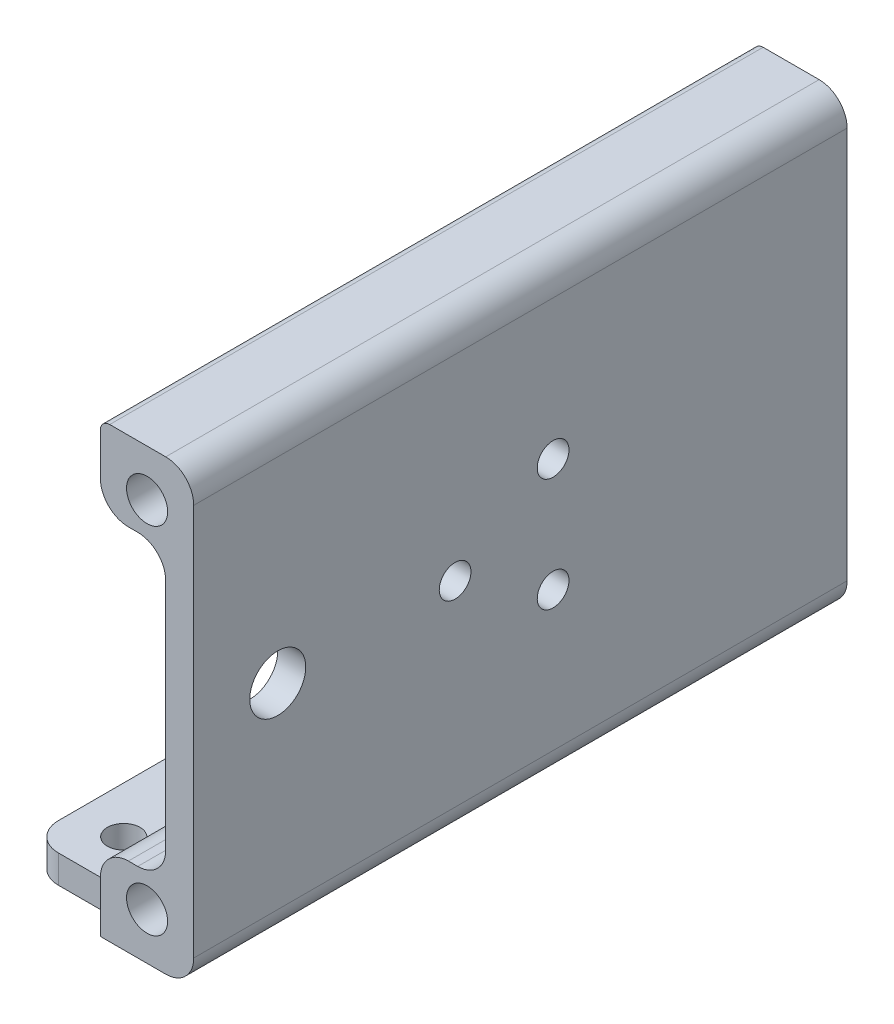
from build123d import *

# Parameters (mm, degrees)
BOSS_EXTRUDE1_DEPTH = 70
SKETCH2_R           = 2.2
CUT_EXTRUDE1_DEPTH  = 5.3
FILLET1_R           = 1
SKETCH4_R           = 1.7
SKETCH4_R_2         = 3
CUT_EXTRUDE3_DEPTH  = 10
SKETCH5_R           = 1.75
BOSS_EXTRUDE2_DEPTH = 3
CHAMFER1_SIZE       = 1


with BuildPart() as part:
    # Sketch1 → Boss-Extrude1 (new body)
    with BuildSketch(Plane.XY):
        with BuildLine():
            Line((49, 24), (49, 18.5))
            ThreePointArc((49, 18.5), (49.878679656, 16.378679656), (52, 15.5))
            Line((52, 15.5), (53, 15.5))
            ThreePointArc((53, 15.5), (55.121320344, 14.621320344), (56, 12.5))
            Line((56, 12.5), (56, -12.5))
            ThreePointArc((56, -12.5), (55.121320344, -14.621320344), (53, -15.5))
            Line((53, -15.5), (52, -15.5))
            ThreePointArc((52, -15.5), (49.878679656, -16.378679656), (49, -18.5))
            Line((49, -18.5), (49, -24))
            Line((49, -24), (56, -24))
            ThreePointArc((56, -24), (58.121320344, -23.121320344), (59, -21))
            Line((59, -21), (59, 21))
            ThreePointArc((59, 21), (58.121320344, 23.121320344), (56, 24))
            Line((56, 24), (49, 24))
        make_face()
    extrude(amount=BOSS_EXTRUDE1_DEPTH)

    # Sketch2 → Cut-Extrude1 (cut)
    with BuildSketch(Plane(origin=(0, 0, 0), x_dir=(-1, 0, 0), z_dir=(0, 0, -1))):
        with Locations((-54, -19)):
            Circle(SKETCH2_R)
        with Locations((-54, 19)):
            Circle(SKETCH2_R)
    cut_extrude1 = extrude(amount=-CUT_EXTRUDE1_DEPTH, mode=Mode.SUBTRACT)

    # Mirror1: Cut-Extrude1 across plane
    add(cut_extrude1.mirror(Plane(origin=(0, 0, 35), x_dir=(1, 0, 0), z_dir=(0, 0, -1))), mode=Mode.SUBTRACT)

    # Fillet1
    fillet1_edges = [part.edges().sort_by_distance(p)[0] for p in [
        (49, 24, 35),
    ]]
    fillet(fillet1_edges, radius=FILLET1_R)

    # Sketch4 → Cut-Extrude3 (cut)
    with BuildSketch(Plane(origin=(59, 0, 0), x_dir=(0, 0, -1), z_dir=(1, 0, 0))):
        with Locations((-42, 0)):
            Circle(SKETCH4_R)
        with Locations((-31.5, 6.062177826)):
            Circle(SKETCH4_R)
        with Locations((-31.5, -6.062177826)):
            Circle(SKETCH4_R)
        with Locations((-61, 0)):
            Circle(SKETCH4_R_2)
    extrude(amount=-CUT_EXTRUDE3_DEPTH, mode=Mode.SUBTRACT)

    # Sketch5 → Boss-Extrude2 (add)
    with BuildSketch(Plane.XZ.offset(24)):
        with BuildLine():
            Line((49, 2.5), (42, 2.5))
            ThreePointArc((42, 2.5), (39.878679656, 3.378679656), (39, 5.5))
            Line((39, 5.5), (39, 64.5))
            ThreePointArc((39, 64.5), (39.878679656, 66.621320344), (42, 67.5))
            Line((42, 67.5), (49, 67.5))
            Line((49, 67.5), (49, 2.5))
        make_face()
        with Locations((44, 62.5)):
            Circle(SKETCH5_R, mode=Mode.SUBTRACT)
        with Locations((44, 7.5)):
            Circle(SKETCH5_R, mode=Mode.SUBTRACT)
    extrude(amount=-BOSS_EXTRUDE2_DEPTH)

    # Chamfer1
    chamfer1_edges = [part.edges().sort_by_distance(p)[0] for p in [
        (49, -22.5, 2.5),
        (49, -21, 35),
        (49, -22.5, 67.5),
    ]]
    chamfer(chamfer1_edges, length=CHAMFER1_SIZE)


solid = part.part
